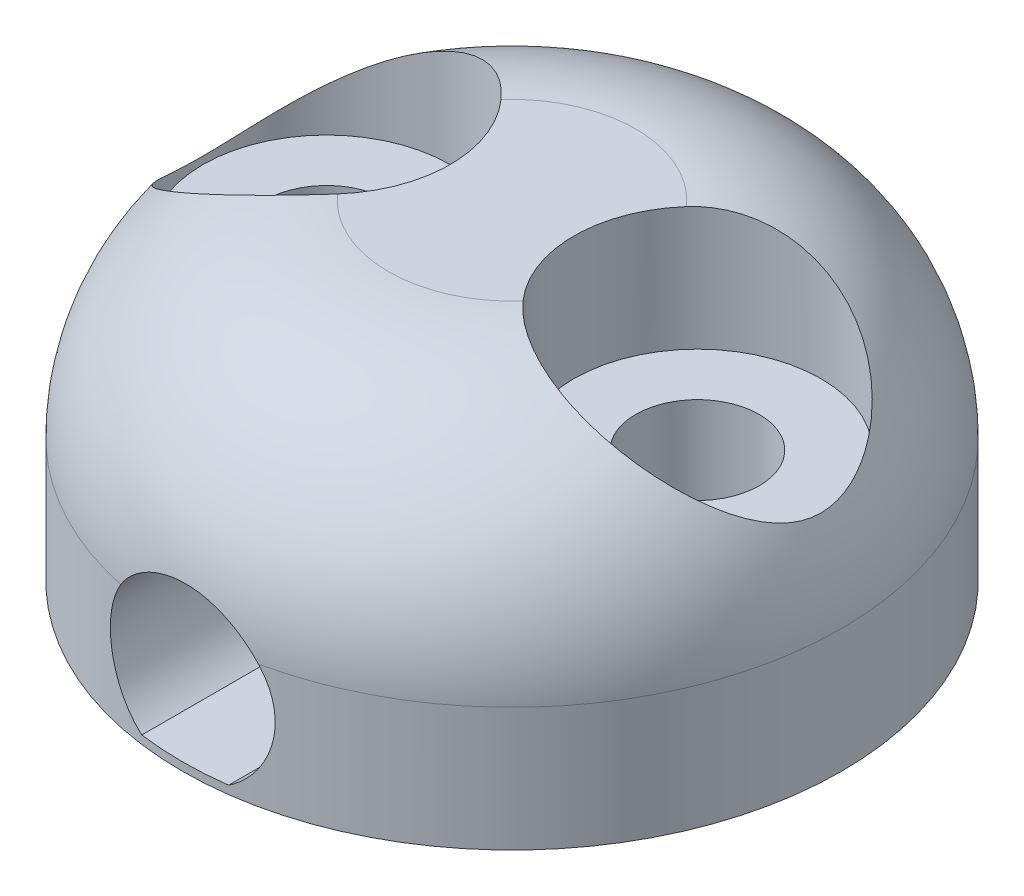
from build123d import *

# Parameters (mm, degrees)
ESQUISSE1_R             = 8
ESQUISSE1_R_2           = 1.5
BOSS_EXTRU_1_DEPTH      = 8
ESQUISSE2_R             = 3
ENL_V_MAT_EXTRU_1_DEPTH = 3
ESQUISSE3_R             = 2
ENL_V_MAT_EXTRU_2_DEPTH = 20
CONG_1_R                = 5
ESQUISSE4_R             = 8
BOSS_EXTRU_2_DEPTH      = 0.2


with BuildPart() as part:
    # Esquisse1 → Boss.-Extru.1 (new body)
    with BuildSketch(Plane(origin=(0, 0, 0), x_dir=(1, 0, 0), z_dir=(0, 1, 0))):
        with Locations(Location((0, 0, 0), (0, 0, 270))):
            Circle(ESQUISSE1_R)
        with Locations(Location((-4.5, 0, 0), (0, 0, 270))):
            Circle(ESQUISSE1_R_2, mode=Mode.SUBTRACT)
        with Locations(Location((4.5, 0, 0), (0, 0, 90))):
            Circle(ESQUISSE1_R_2, mode=Mode.SUBTRACT)
    extrude(amount=BOSS_EXTRU_1_DEPTH)

    # Esquisse2 → Enlèv. mat.-Extru.1 (cut)
    with BuildSketch(Plane(origin=(0, 8, 0), x_dir=(1, 0, 0), z_dir=(0, 1, 0))):
        with Locations(Location((-4.5, 0, 0), (0, 0, 270))):
            Circle(ESQUISSE2_R)
        with Locations(Location((4.5, 0, 0), (0, 0, 270))):
            Circle(ESQUISSE2_R)
    extrude(amount=-ENL_V_MAT_EXTRU_1_DEPTH, mode=Mode.SUBTRACT)

    # Esquisse3 → Enlèv. mat.-Extru.2 (cut, symmetric)
    with BuildSketch(Plane.XY):
        with Locations((0, 1.9)):
            Circle(ESQUISSE3_R)
    extrude(amount=ENL_V_MAT_EXTRU_2_DEPTH, both=True, mode=Mode.SUBTRACT)

    # Congé1
    # the kernel refuses this fillet: 5 mm, written as the material it takes off along each edge
    with BuildSketch(Plane(origin=(0, 8, 0), x_dir=(0, 0, 1), z_dir=(-1, 0, 0))) as cong_1_piece_1:
        with BuildLine():
            CenterArc((8 - CONG_1_R, -CONG_1_R), CONG_1_R, 0, 90)
            Line((8 - CONG_1_R, 0), (8, 0))
            Line((8, 0), (8, -CONG_1_R))
        make_face()
    revolve(axis=Axis((0, 8, 0), (0, 1, 0)), mode=Mode.SUBTRACT)

    # Esquisse4 → Boss.-Extru.2 (add)
    with BuildSketch(Plane.XZ):
        with Locations(Location((0, 0, 0), (0, 0, 262.432428308))):
            Circle(ESQUISSE4_R)
    extrude(amount=-BOSS_EXTRU_2_DEPTH)


solid = part.part
